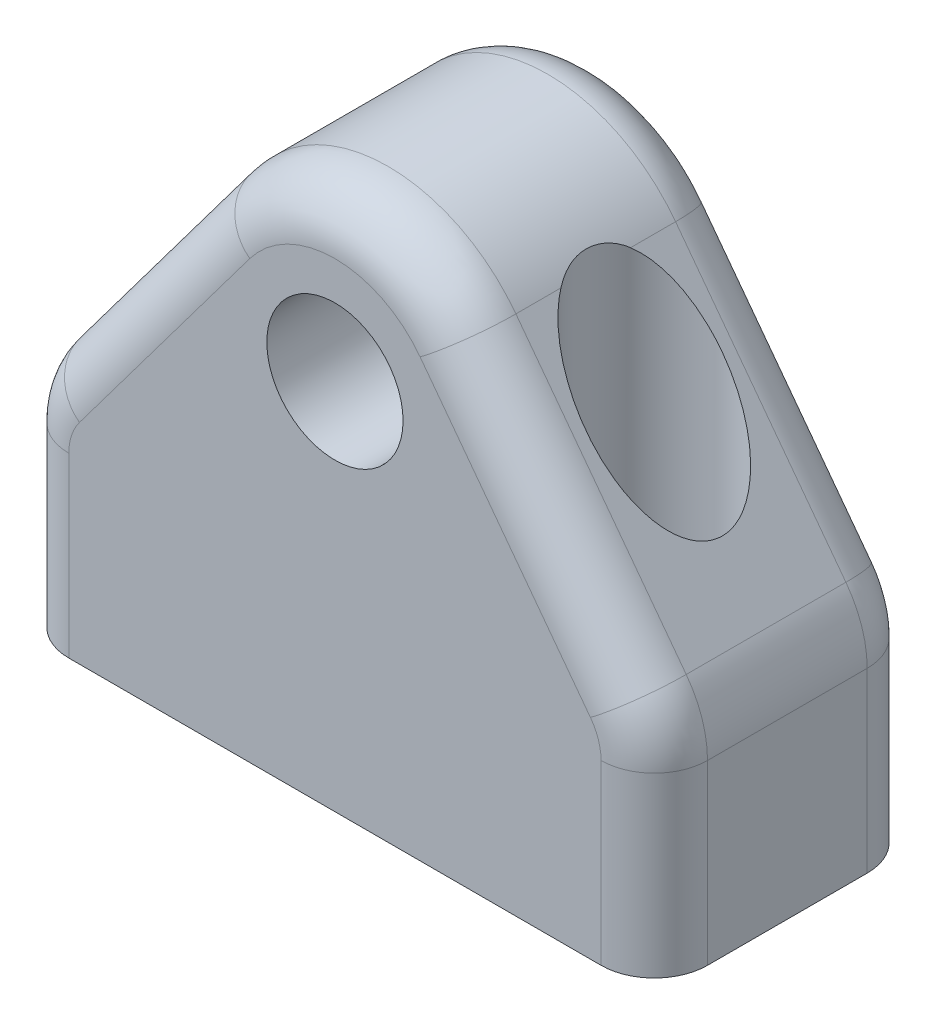
from build123d import *

# Parameters (mm, degrees)
SKETCH1_R           = 2.032
BOSS_EXTRUDE1_DEPTH = 7.9375
SKETCH2_R           = 2.032
CUT_EXTRUDE1_DEPTH  = 27.036935904
FILLET1_R           = 1.5875


with BuildPart() as part:
    # Sketch1 → Boss-Extrude1 (new body)
    with BuildSketch(Plane.XY):
        with BuildLine():
            Line((0, 0), (0, 5.291666667))
            ThreePointArc((0, 5.291666667), (0.162930529, 6.295689824), (0.635, 7.196666667))
            Line((0.635, 7.196666667), (5.715, 13.97))
            ThreePointArc((5.715, 13.97), (9.525, 15.875), (13.335, 13.97))
            Line((13.335, 13.97), (18.415, 7.196666667))
            ThreePointArc((18.415, 7.196666667), (18.887069471, 6.295689824), (19.05, 5.291666667))
            Line((19.05, 5.291666667), (19.05, 0))
            Line((19.05, 0), (0, 0))
        make_face()
        with Locations((9.525, 11.1125)):
            Circle(SKETCH1_R, mode=Mode.SUBTRACT)
    extrude(amount=BOSS_EXTRUDE1_DEPTH)

    # Sketch2 → Cut-Extrude1 (cut, through all)
    with BuildSketch(Plane.XZ):
        with Locations((3.96875, 3.96875)):
            Circle(SKETCH2_R)
        with Locations((15.08125, 3.96875)):
            Circle(SKETCH2_R)
    extrude(amount=-CUT_EXTRUDE1_DEPTH, mode=Mode.SUBTRACT)

    # Fillet1
    fillet1_edges = [part.edges().sort_by_distance(p)[0] for p in [
        (19.05, 2.645833333, 0),
        (18.887069471, 6.295689824, 0),
        (15.875, 10.583333333, 0),
        (0, 2.645833333, 0),
        (0.162930529, 6.295689824, 0),
        (3.175, 10.583333333, 0),
        (19.05, 2.645833333, 7.9375),
        (18.887069471, 6.295689824, 7.9375),
        (15.875, 10.583333333, 7.9375),
        (0, 2.645833333, 7.9375),
        (0.162930529, 6.295689824, 7.9375),
        (3.175, 10.583333333, 7.9375),
        (9.525, 15.875, 0),
        (9.525, 15.875, 7.9375),
    ]]
    fillet(fillet1_edges, radius=FILLET1_R)


solid = part.part
